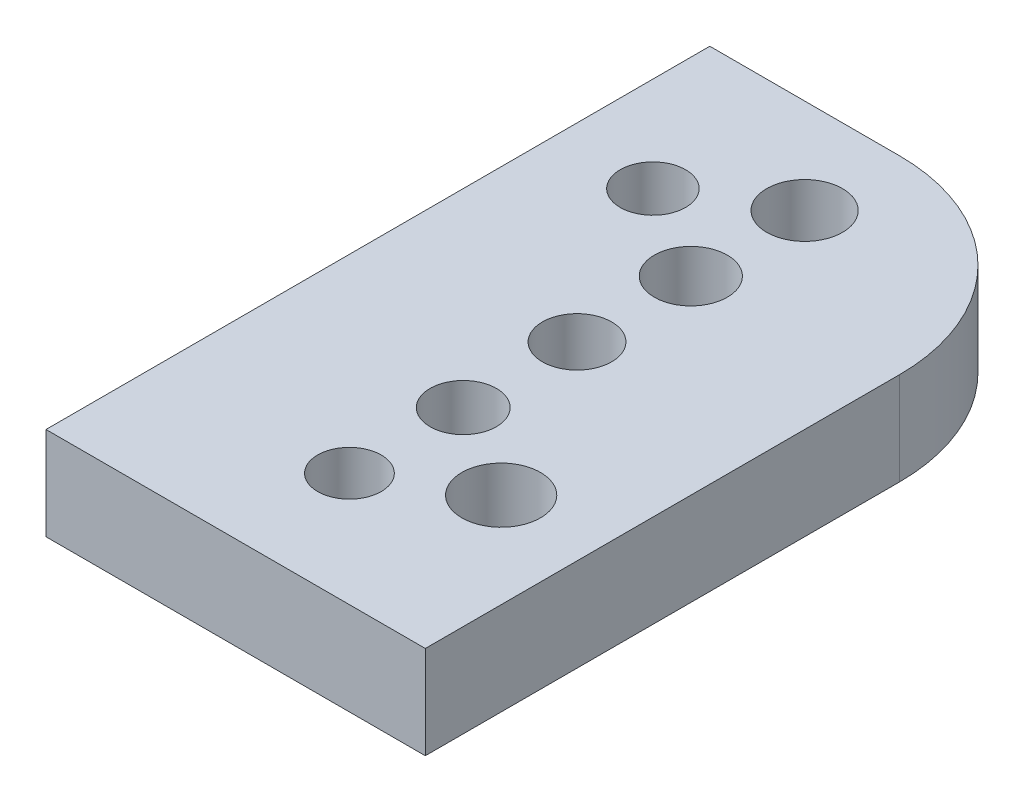
from build123d import *

# Parameters (mm, degrees)
ESQUISSE1_W             = 20
ESQUISSE1_H             = 35
BOSS_EXTRU_1_DEPTH      = 4.9
ENL_V_MAT_EXTRU_1_REACH = 22.743
ESQUISSE2_R             = 1.675
ESQUISSE2_R_2           = 1.75
ESQUISSE2_R_3           = 1.825
ESQUISSE2_R_4           = 1.925
ESQUISSE2_R_5           = 2
ESQUISSE2_R_6           = 2.075
ESQUISSE2_R_7           = 1.725
CONG_1_R                = 10


with BuildPart() as part:
    # Esquisse1 → Boss.-Extru.1 (new body)
    with BuildSketch(Plane(origin=(0, 0, 0), x_dir=(1, 0, 0), z_dir=(0, 1, 0))):
        Rectangle(ESQUISSE1_W, ESQUISSE1_H)
    extrude(amount=BOSS_EXTRU_1_DEPTH)

    # Esquisse2 → Enlèv. mat.-Extru.1 (cut, up to next)
    with BuildSketch(Plane(origin=(0, 4.9, 0), x_dir=(1, 0, 0), z_dir=(0, 1, 0)), mode=Mode.PRIVATE) as enl_v_mat_extru_1_sk1:
        with Locations((0, -11.5)):
            Circle(ESQUISSE2_R)
    enl_v_mat_extru_1_tool1 = extrude(enl_v_mat_extru_1_sk1.sketch, amount=-ENL_V_MAT_EXTRU_1_REACH, mode=Mode.PRIVATE) & part.part
    # Esquisse2 → Enlèv. mat.-Extru.1 (cut, up to next)
    with BuildSketch(Plane(origin=(0, 4.9, 0), x_dir=(1, 0, 0), z_dir=(0, 1, 0)), mode=Mode.PRIVATE) as enl_v_mat_extru_1_sk2:
        with Locations((0, -5.5)):
            Circle(ESQUISSE2_R_2)
    enl_v_mat_extru_1_tool2 = extrude(enl_v_mat_extru_1_sk2.sketch, amount=-ENL_V_MAT_EXTRU_1_REACH, mode=Mode.PRIVATE) & part.part
    # Esquisse2 → Enlèv. mat.-Extru.1 (cut, up to next)
    with BuildSketch(Plane(origin=(0, 4.9, 0), x_dir=(1, 0, 0), z_dir=(0, 1, 0)), mode=Mode.PRIVATE) as enl_v_mat_extru_1_sk3:
        with Locations((0, 0.5)):
            Circle(ESQUISSE2_R_3)
    enl_v_mat_extru_1_tool3 = extrude(enl_v_mat_extru_1_sk3.sketch, amount=-ENL_V_MAT_EXTRU_1_REACH, mode=Mode.PRIVATE) & part.part
    # Esquisse2 → Enlèv. mat.-Extru.1 (cut, up to next)
    with BuildSketch(Plane(origin=(0, 4.9, 0), x_dir=(1, 0, 0), z_dir=(0, 1, 0)), mode=Mode.PRIVATE) as enl_v_mat_extru_1_sk4:
        with Locations((0, 6.5)):
            Circle(ESQUISSE2_R_4)
    enl_v_mat_extru_1_tool4 = extrude(enl_v_mat_extru_1_sk4.sketch, amount=-ENL_V_MAT_EXTRU_1_REACH, mode=Mode.PRIVATE) & part.part
    # Esquisse2 → Enlèv. mat.-Extru.1 (cut, up to next)
    with BuildSketch(Plane(origin=(0, 4.9, 0), x_dir=(1, 0, 0), z_dir=(0, 1, 0)), mode=Mode.PRIVATE) as enl_v_mat_extru_1_sk5:
        with Locations((0, 12.5)):
            Circle(ESQUISSE2_R_5)
    enl_v_mat_extru_1_tool5 = extrude(enl_v_mat_extru_1_sk5.sketch, amount=-ENL_V_MAT_EXTRU_1_REACH, mode=Mode.PRIVATE) & part.part
    # Esquisse2 → Enlèv. mat.-Extru.1 (cut, up to next)
    with BuildSketch(Plane(origin=(0, 4.9, 0), x_dir=(1, 0, 0), z_dir=(0, 1, 0)), mode=Mode.PRIVATE) as enl_v_mat_extru_1_sk6:
        with Locations((5, -8.5)):
            Circle(ESQUISSE2_R_6)
    enl_v_mat_extru_1_tool6 = extrude(enl_v_mat_extru_1_sk6.sketch, amount=-ENL_V_MAT_EXTRU_1_REACH, mode=Mode.PRIVATE) & part.part
    # Esquisse2 → Enlèv. mat.-Extru.1 (cut, up to next)
    with BuildSketch(Plane(origin=(0, 4.9, 0), x_dir=(1, 0, 0), z_dir=(0, 1, 0)), mode=Mode.PRIVATE) as enl_v_mat_extru_1_sk7:
        with Locations((-5, 9.5)):
            Circle(ESQUISSE2_R_7)
    enl_v_mat_extru_1_tool7 = extrude(enl_v_mat_extru_1_sk7.sketch, amount=-ENL_V_MAT_EXTRU_1_REACH, mode=Mode.PRIVATE) & part.part
    add(enl_v_mat_extru_1_tool1.solids().sort_by_distance((0, 4.9, 11.5))[0], mode=Mode.SUBTRACT)
    add(enl_v_mat_extru_1_tool2.solids().sort_by_distance((0, 4.9, 5.5))[0], mode=Mode.SUBTRACT)
    add(enl_v_mat_extru_1_tool3.solids().sort_by_distance((0, 4.9, -0.5))[0], mode=Mode.SUBTRACT)
    add(enl_v_mat_extru_1_tool4.solids().sort_by_distance((0, 4.9, -6.5))[0], mode=Mode.SUBTRACT)
    add(enl_v_mat_extru_1_tool5.solids().sort_by_distance((0, 4.9, -12.5))[0], mode=Mode.SUBTRACT)
    add(enl_v_mat_extru_1_tool6.solids().sort_by_distance((5, 4.9, 8.5))[0], mode=Mode.SUBTRACT)
    add(enl_v_mat_extru_1_tool7.solids().sort_by_distance((-5, 4.9, -9.5))[0], mode=Mode.SUBTRACT)

    # Congé1
    cong_1_edges = [part.edges().sort_by_distance(p)[0] for p in [
        (10, 2.45, -17.5),
    ]]
    fillet(cong_1_edges, radius=CONG_1_R)


solid = part.part
